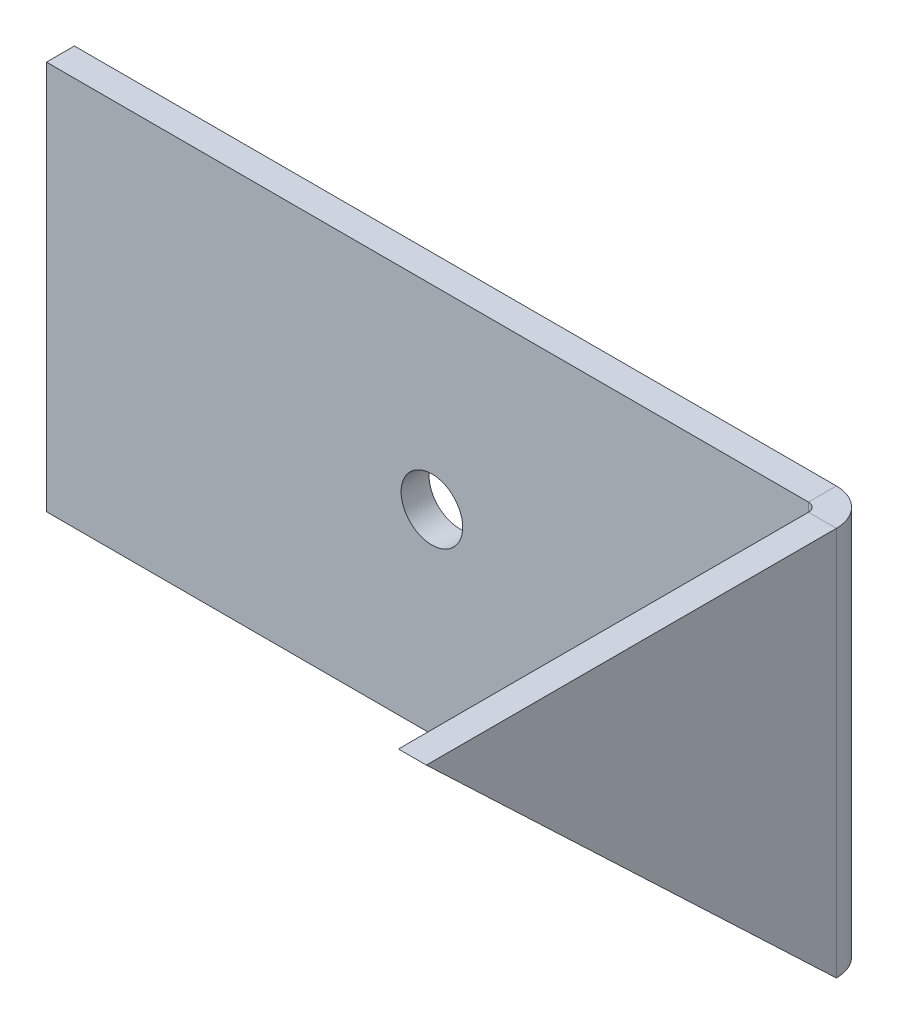
from build123d import *

# Parameters (mm, degrees)
SKETCH1_W                    = 87.64016
SKETCH1_H                    = 44.27474
SKETCH1_R                    = 3
BASE_FLANGE1_DEPTH           = 3.175
EDGE_FLANGE2_STRIP_W         = 14.7
EDGE_FLANGE2_STRIP_H         = 3.175
EDGE_FLANGE2_STRIP_CUT_DEPTH = 44.27474
EDGE_FLANGE2_DEPTH           = 44.27474
CUT_EXTRUDE2_DEPTH           = 107.386542553
CUT_EXTRUDE2_DEPTH_BACK      = 3.175
M6_CLEARANCE_HOLE2_D         = 7
M6_CLEARANCE_HOLE2_DEPTH     = 3.175


# Sheet-metal steps are written as plain solids
with BuildPart() as part:
    # Sketch1 → Base-Flange1 (new body)
    with BuildSketch(Plane.XY):
        Rectangle(SKETCH1_W, SKETCH1_H)
        Circle(SKETCH1_R, mode=Mode.SUBTRACT)
    extrude(amount=BASE_FLANGE1_DEPTH)

    # Edge-Flange2 strip (across the edge) → Edge-Flange2 strip cut (cut)
    with BuildSketch(Plane(origin=(43.82008, -22.13737, 3.175), x_dir=(-1, 0, 0), z_dir=(0, 1, 0))):
        with Locations((-6.35, -1.5875)):
            Rectangle(EDGE_FLANGE2_STRIP_W, EDGE_FLANGE2_STRIP_H)
    extrude(amount=EDGE_FLANGE2_STRIP_CUT_DEPTH, mode=Mode.SUBTRACT)

    # Edge-Flange2 section (across the edge) → Edge-Flange2 (add)
    with BuildSketch(Plane(origin=(43.82008, -22.13737, 3.175), x_dir=(-1, 0, 0), z_dir=(0, 1, 0))):
        with BuildLine():
            Line((-3.175, 1), (-3.175, 47.625))
            Line((-3.175, 47.625), (0, 47.625))
            Line((0, 47.625), (0, 1))
            ThreePointArc((0, 1), (0.292893219, 0.292893219), (1, 0))
            Line((1, 0), (1, -3.175))
            ThreePointArc((1, -3.175), (-1.952170811, -1.952170811), (-3.175, 1))
        make_face()
    extrude(amount=EDGE_FLANGE2_DEPTH)

    # Sketch13 → Cut-Extrude2 (cut, two sides: drawn at the far end of the back side and taken through both)
    with BuildSketch(Plane(origin=(46.99508, 0, 0), x_dir=(0, 0, -1), z_dir=(1, 0, 0)).offset(-CUT_EXTRUDE2_DEPTH_BACK)):
        Polygon((-4.175, -22.13737), (-50.8, 22.13737), (-50.8, -22.13737), align=None)
    extrude(amount=CUT_EXTRUDE2_DEPTH + CUT_EXTRUDE2_DEPTH_BACK, mode=Mode.SUBTRACT)

    # M6 Clearance Hole2
    with Locations(Plane.XY.offset(3.175)):
        with Locations((0, 0)):
            Hole(M6_CLEARANCE_HOLE2_D / 2, depth=M6_CLEARANCE_HOLE2_DEPTH)


solid = part.part
